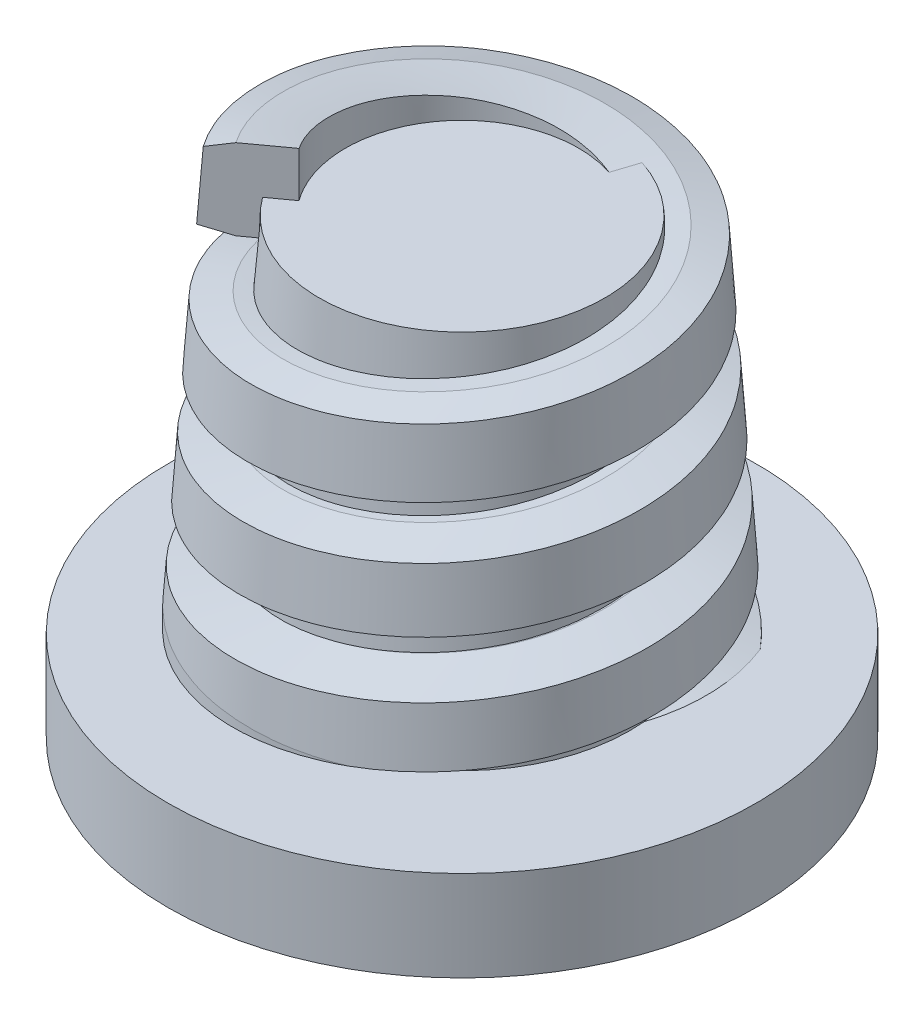
from build123d import *

# Parameters (mm, degrees)
SKETCH1_R           = 6.5
BOSS_EXTRUDE1_DEPTH = 2
SKETCH5_R           = 3.716517187
BOSS_EXTRUDE5_DEPTH = 8
BOSS_EXTRUDE5_TAPER = 4
SWEEP1_PITCH        = 2.5


# Read off the part's stored shape, not the designer's step: taper
with BuildPart() as part:
    # Sketch1 → Boss-Extrude1 (new body)
    with BuildSketch(Plane(origin=(0, 0, 0), x_dir=(1, 0, 0), z_dir=(0, 1, 0))):
        with Locations(Location((0, 0, 0), (0, 0, 270))):
            Circle(SKETCH1_R)
    extrude(amount=BOSS_EXTRUDE1_DEPTH)

    # Sketch5 → Boss-Extrude5 (add)
    with BuildSketch(Plane(origin=(0, 2, 0), x_dir=(1, 0, 0), z_dir=(0, 1, 0))):
        Circle(SKETCH5_R)
    extrude(amount=BOSS_EXTRUDE5_DEPTH, taper=BOSS_EXTRUDE5_TAPER)

    # Sweep1: the profile of thread_xsec screwed along a right-hand helix of 3.6 turns, 10 arcs to a turn; built about Z, then put on its axis
    sweep1_z = Axis((0, 0, 0), (0, 0, 1))
    sweep1_corners = [(3.579951278, 0, 0), (4.679951278, 0, -0.275), (4.679951278, 0, -1.509232922), (3.579951278, 0, -1.784232922), (2.579951278, 0, -1.784232922), (2.579951278, 0, 0)]
    with BuildLine(mode=Mode.PRIVATE) as sweep1_profile:
        Line(sweep1_corners[0], sweep1_corners[1])
        Line(sweep1_corners[1], sweep1_corners[2])
        Line(sweep1_corners[2], sweep1_corners[3])
        Line(sweep1_corners[3], sweep1_corners[4])
        Line(sweep1_corners[4], sweep1_corners[5])
        Line(sweep1_corners[5], sweep1_corners[0])
    sweep1_cap = Face(sweep1_profile.wire())
    sweep1_turn_angles = [0, 18, 36, 54, 72, 90, 108, 126, 144, 162, 180, 198, 216, 234, 252, 270, 288, 306, 324, 342, 360]
    sweep1_turn_weights = [1, 0.9510565162951535, 1, 0.9510565162951535, 1, 0.9510565162951535, 1, 0.9510565162951535, 1, 0.9510565162951535, 1, 0.9510565162951535, 1, 0.9510565162951535, 1, 0.9510565162951535, 1, 0.9510565162951535, 1, 0.9510565162951535, 1]
    sweep1_turn_rails = [Edge.make_bspline([Vector(p[0], p[1], 0).rotate(sweep1_z, sweep1_turn_angles[k]) / sweep1_turn_weights[k] + Vector(0, 0, p[2] + SWEEP1_PITCH * sweep1_turn_angles[k] / 360) for k in range(21)], [0, 0, 0, 1, 1, 2, 2, 3, 3, 4, 4, 5, 5, 6, 6, 7, 7, 8, 8, 9, 9, 10, 10, 10], 2, sweep1_turn_weights) for p in sweep1_corners]
    sweep1_turn_sides = [Face.make_surface_from_curves(sweep1_turn_rails[p[0]], sweep1_turn_rails[p[1]]) for p in [(0, 1), (1, 2), (2, 3), (3, 4), (4, 5), (5, 0)]]
    sweep1_last_angles = [1080, 1098, 1116, 1134, 1152, 1170, 1188, 1206, 1224, 1242, 1260, 1278, 1296]
    sweep1_last_weights = [1, 0.9510565162951535, 1, 0.9510565162951535, 1, 0.9510565162951535, 1, 0.9510565162951535, 1, 0.9510565162951535, 1, 0.9510565162951444, 1]
    sweep1_last_rails = [Edge.make_bspline([Vector(p[0], p[1], 0).rotate(sweep1_z, sweep1_last_angles[k]) / sweep1_last_weights[k] + Vector(0, 0, p[2] + SWEEP1_PITCH * sweep1_last_angles[k] / 360) for k in range(13)], [0, 0, 0, 1, 1, 2, 2, 3, 3, 4, 4, 5, 5, 6, 6, 6], 2, sweep1_last_weights) for p in sweep1_corners]
    sweep1_last_sides = [Face.make_surface_from_curves(sweep1_last_rails[p[0]], sweep1_last_rails[p[1]]) for p in [(0, 1), (1, 2), (2, 3), (3, 4), (4, 5), (5, 0)]]
    sweep1 = Plane(origin=(0, 2, 0), x_dir=(1, 0, 0), z_dir=(0, 1, 0)) * Solid(Shell([*[p.moved(Location((0, 0, SWEEP1_PITCH * i))) for i in range(3) for p in sweep1_turn_sides], *sweep1_last_sides, sweep1_cap, sweep1_cap.rotate(sweep1_z, 1296).moved(Location((0, 0, SWEEP1_PITCH * 1296 / 360)))]))
    add(sweep1)

    # taper outline → taper (revolve, cut)
    with BuildSketch(Plane.XY):
        Polygon((4.679951313, 10.87093762), (4.0962008, 10.87093762), (4.679951313, 2.522916363), align=None)
    revolve(axis=Axis((0, 0, 0), (0, 1, 0)), mode=Mode.SUBTRACT)


solid = part.part
